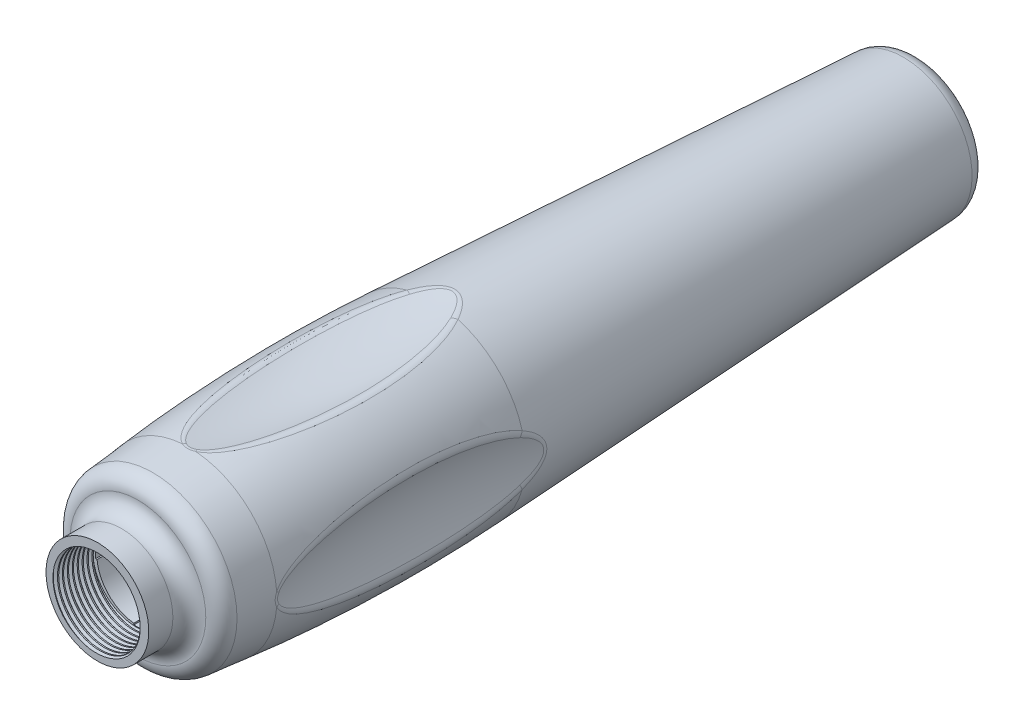
from build123d import *

# Parameters (mm, degrees)
BOSS_EXTRUDE1_DEPTH      = 51
BOSS_EXTRUDE1_DEPTH_BACK = 35
SKETCH1_R                = 11.25
SKETCH1_R_2              = 5
SKETCH2_R                = 11.25
BOSS_EXTRUDE2_DEPTH      = 9
CUT_EXTRUDE1_DEPTH       = 6
CUT_EXTRUDE2_START       = -2.5
SKETCH4_W                = 10
SKETCH4_H                = 2.5
CUT_EXTRUDE2_DEPTH       = 5
SKETCH5_R                = 2.5
CUT_EXTRUDE3_DEPTH       = 7.5
SKETCH6_W                = 1
SKETCH6_H                = 0.25
SKETCH6_W_2              = 0.25
SKETCH6_H_2              = 1
CUT_EXTRUDE4_DEPTH       = 10
SKETCH7_W                = 22.5
SKETCH7_H                = 22.5
SKETCH7_R                = 7.5
BOSS_EXTRUDE3_DEPTH      = 55
SKETCH11_R               = 6.25
SKETCH11_R_2             = 5.5
BOSS_EXTRUDE4_DEPTH      = 5
THREAD1_PITCH            = 0.6
SKETCH14_W               = 14.477531198
SKETCH14_H               = 32.54061919
CUT_EXTRUDE5_DEPTH       = 30
CIRPATTERN1_COUNT        = 4
FILLET11_R               = 198
FILLET13_R               = 1.25
FILLET14_R               = 2
FILLET15_R               = 2


with BuildPart() as part:
    # Sketch1 → Boss-Extrude1 (new, two sides: drawn at the far end of the back side and taken through both)
    with BuildSketch(Plane.XY.offset(-BOSS_EXTRUDE1_DEPTH_BACK)):
        Circle(SKETCH1_R)
        Circle(SKETCH1_R_2, mode=Mode.SUBTRACT)
    extrude(amount=BOSS_EXTRUDE1_DEPTH + BOSS_EXTRUDE1_DEPTH_BACK)

    # Sketch2 → Boss-Extrude2 (add)
    with BuildSketch(Plane(origin=(0, 0, -35), x_dir=(-1, 0, 0), z_dir=(0, 0, -1))):
        with Locations(Location((0, 0, 0), (0, 0, 180))):
            Circle(SKETCH2_R)
    extrude(amount=BOSS_EXTRUDE2_DEPTH)

    # Sketch3 → Cut-Extrude1 (cut)
    with BuildSketch(Plane(origin=(0, 0, -44), x_dir=(-1, 0, 0), z_dir=(0, 0, -1))):
        Polygon((-2, 4.5), (-3, 3.5), (-3, 2.5), (3, 2.5), (3, 3.5), (2, 4.5), align=None)
    extrude(amount=-CUT_EXTRUDE1_DEPTH, mode=Mode.SUBTRACT)

    # Sketch4 → Cut-Extrude2 (cut)
    with BuildSketch(Plane(origin=(0, 0, -44), x_dir=(-1, 0, 0), z_dir=(0, 0, -1)).offset(CUT_EXTRUDE2_START)):
        with Locations((0, -2.25)):
            Rectangle(SKETCH4_W, SKETCH4_H)
    extrude(amount=-CUT_EXTRUDE2_DEPTH, mode=Mode.SUBTRACT)

    # Sketch5 → Cut-Extrude3 (cut)
    with BuildSketch(Plane(origin=(0, 0, -44), x_dir=(-1, 0, 0), z_dir=(0, 0, -1))):
        with Locations((0, -3.5)):
            Circle(SKETCH5_R)
    extrude(amount=-CUT_EXTRUDE3_DEPTH, mode=Mode.SUBTRACT)

    # Sketch6 → Cut-Extrude4 (cut)
    with BuildSketch(Plane.XY.offset(51)):
        with Locations((0, 5.025)):
            Rectangle(SKETCH6_W, SKETCH6_H)
        with Locations((-5.025, 0)):
            Rectangle(SKETCH6_W_2, SKETCH6_H_2)
        with Locations((5.025, 0)):
            Rectangle(SKETCH6_W_2, SKETCH6_H_2)
        with Locations((0, -5.025)):
            Rectangle(SKETCH6_W, SKETCH6_H)
    extrude(amount=-CUT_EXTRUDE4_DEPTH, mode=Mode.SUBTRACT)

    # Sketch7 → Boss-Extrude3 (add)
    with BuildSketch(Plane.XY.offset(51)):
        Rectangle(SKETCH7_W, SKETCH7_H)
        Circle(SKETCH7_R, mode=Mode.SUBTRACT)
    extrude(amount=-BOSS_EXTRUDE3_DEPTH)

    # Sketch11 → Boss-Extrude4 (add)
    with BuildSketch(Plane.XY.offset(51)):
        Circle(SKETCH11_R)
        Circle(SKETCH11_R_2, mode=Mode.SUBTRACT)
    extrude(amount=BOSS_EXTRUDE4_DEPTH)

    # Thread1: the profile of Thread Profile1 profile screwed along a right-hand helix of 10 turns, 6 arcs to a turn; built about Z, then put on its axis
    thread1_z = Axis((0, 0, 0), (0, 0, 1))
    thread1_corners = [(5.5003, 0, -0.000173205), (5.5003, 0, 0.525173203), (5.175240475, 0, 0.337499999), (5.175240475, 0, 0.187499999)]
    with BuildLine(mode=Mode.PRIVATE) as thread1_profile:
        Line(thread1_corners[0], thread1_corners[1])
        Line(thread1_corners[1], thread1_corners[2])
        Line(thread1_corners[2], thread1_corners[3])
        Line(thread1_corners[3], thread1_corners[0])
    thread1_cap = Face(thread1_profile.wire())
    thread1_turn_angles = [0, 30, 60, 90, 120, 150, 180, 210, 240, 270, 300, 330, 360]
    thread1_turn_weights = [1, 0.8660254037844387, 1, 0.8660254037844387, 1, 0.8660254037844387, 1, 0.8660254037844387, 1, 0.8660254037844387, 1, 0.8660254037844387, 1]
    thread1_turn_rails = [Edge.make_bspline([Vector(p[0], p[1], 0).rotate(thread1_z, thread1_turn_angles[k]) / thread1_turn_weights[k] + Vector(0, 0, p[2] + THREAD1_PITCH * thread1_turn_angles[k] / 360) for k in range(13)], [0, 0, 0, 1, 1, 2, 2, 3, 3, 4, 4, 5, 5, 6, 6, 6], 2, thread1_turn_weights) for p in thread1_corners]
    thread1_turn_sides = [Face.make_surface_from_curves(thread1_turn_rails[p[0]], thread1_turn_rails[p[1]]) for p in [(0, 1), (1, 2), (2, 3), (3, 0)]]
    thread1 = Plane(origin=(0, 0, 57), x_dir=(-1, 0, 0), z_dir=(0, 0, -1)) * Solid(Shell([*[p.moved(Location((0, 0, THREAD1_PITCH * i))) for i in range(10) for p in thread1_turn_sides], thread1_cap, thread1_cap.rotate(thread1_z, 3600).moved(Location((0, 0, THREAD1_PITCH * 3600 / 360)))]))
    add(thread1)

    # Sketch14 → Cut-Extrude5 (cut)
    with BuildSketch(Plane(origin=(11.25, 0, 0), x_dir=(0, 0, -1), z_dir=(1, 0, 0))):
        with Locations((-63.170516655, 2.469298546)):
            Rectangle(SKETCH14_W, SKETCH14_H)
    extrude(amount=-CUT_EXTRUDE5_DEPTH, mode=Mode.SUBTRACT)

    # Sketch15 → Cut-Revolve2 (revolve, cut)
    with BuildSketch(Plane(origin=(0, 0, 0), x_dir=(1, 0, 0), z_dir=(0, 1, 0)), mode=Mode.PRIVATE) as cut_revolve2_sk:
        Polygon((-8.2, 44.75), (-12.117481501, -30), (-8.213792673, -70), (-14.213792673, -70), (-53.2, -813.901150948), (-53.2, 44.75), align=None)
    revolve(cut_revolve2_sk.sketch.rotate(Axis((0, 0, 0), (0, 0, -1)), 21.811581298), axis=Axis((0, 0, 0), (0, 0, -1)), mode=Mode.SUBTRACT)

    # Sketch17 → Cut-Revolve3 (revolve, cut)
    with BuildSketch(Plane(origin=(0, 22.25, 0), x_dir=(1, 0, 0), z_dir=(0, 1, 0))):
        with BuildLine():
            Line((0, 8.75), (0, -80.25))
            add(Edge.make_bspline(
                [(0, 8.75), (-11.417317651, -3.383405443), (-15.561847279, -36.022081674), (-7.523975784, -66.531911088), (0, -80.25)],
                knots=[0, 0, 0, 0, 0.50411991, 1, 1, 1, 1], degree=3))
        make_face()
    cut_revolve3 = revolve(axis=Axis((0, 22.25, -8.75), (0, 0, 1)), mode=Mode.SUBTRACT)

    # CirPattern1: Cut-Revolve3 ×4 about axis
    cirpattern1_axis = Axis((0, 0, 56), (0, 0, -1))
    for i in range(1, CIRPATTERN1_COUNT):
        add(cut_revolve3.rotate(cirpattern1_axis, i * 360 / CIRPATTERN1_COUNT), mode=Mode.SUBTRACT)

    # Fillet11
    # the kernel refuses this fillet: 198 mm, written as the material it takes off along each edge
    with BuildSketch(Plane(origin=(0, 0, 30), x_dir=(0.7093247295722744, 0.7048818539423609, 0), z_dir=(-0.7048818539423609, 0.7093247295722744, 0))) as fillet11_piece_1:
        with BuildLine():
            CenterArc((12.117481501 - FILLET11_R * 1.00255274023, FILLET11_R * 0.0225232637006), FILLET11_R, 354.426028867, 8.573971133)
            Line((12.117481501 - FILLET11_R * 0.0039232054761, FILLET11_R * 0.0748592199435), (12.117481501, 0))
            Line((12.117481501, 0), (12.117481501 - FILLET11_R * 0.00728111206666, -FILLET11_R * 0.0746075047085))
        make_face()
    revolve(axis=Axis((0, 0, 30), (0, 0, -1)), revolution_arc=359.64, mode=Mode.SUBTRACT)
    with BuildSketch(Plane(origin=(0, 0, 30), x_dir=(-0.7048818539423612, 0.7093247295722741, 0), z_dir=(-0.7093247295722741, -0.7048818539423612, 0))) as fillet11_piece_2:
        with BuildLine():
            CenterArc((12.117481501 - FILLET11_R * 1.00255274023, FILLET11_R * 0.0225232637006), FILLET11_R, 354.426028867, 8.573971133)
            Line((12.117481501 - FILLET11_R * 0.0039232054761, FILLET11_R * 0.0748592199435), (12.117481501, 0))
            Line((12.117481501, 0), (12.117481501 - FILLET11_R * 0.00728111206666, -FILLET11_R * 0.0746075047085))
        make_face()
    revolve(axis=Axis((0, 0, 30), (0, 0, -1)), revolution_arc=359.64, mode=Mode.SUBTRACT)
    with BuildSketch(Plane(origin=(0, 0, 30), x_dir=(0.704881853942361, -0.7093247295722742, 0), z_dir=(0.7093247295722742, 0.704881853942361, 0))) as fillet11_piece_3:
        with BuildLine():
            CenterArc((12.117481501 - FILLET11_R * 1.00255274023, FILLET11_R * 0.0225232637006), FILLET11_R, 354.426028867, 8.573971133)
            Line((12.117481501 - FILLET11_R * 0.0039232054761, FILLET11_R * 0.0748592199435), (12.117481501, 0))
            Line((12.117481501, 0), (12.117481501 - FILLET11_R * 0.00728111206666, -FILLET11_R * 0.0746075047085))
        make_face()
    revolve(axis=Axis((0, 0, 30), (0, 0, -1)), revolution_arc=359.64, mode=Mode.SUBTRACT)
    with BuildSketch(Plane(origin=(0, 0, 30), x_dir=(-0.709324729572274, -0.7048818539423612, 0), z_dir=(0.7048818539423612, -0.709324729572274, 0))) as fillet11_piece_4:
        with BuildLine():
            CenterArc((12.117481501 - FILLET11_R * 1.00255274023, FILLET11_R * 0.0225232637006), FILLET11_R, 354.426028867, 8.573971133)
            Line((12.117481501 - FILLET11_R * 0.0039232054761, FILLET11_R * 0.0748592199435), (12.117481501, 0))
            Line((12.117481501, 0), (12.117481501 - FILLET11_R * 0.00728111206666, -FILLET11_R * 0.0746075047085))
        make_face()
    revolve(axis=Axis((0, 0, 30), (0, 0, -1)), revolution_arc=359.64, mode=Mode.SUBTRACT)

    # Fillet13
    fillet13_edges = [part.edges().sort_by_distance(p)[0] for p in [
        (-10.671553962, -1.23e-07, 44.816012237),
        (3e-09, -10.671553963, 44.816012256),
        (10.671553963, 3e-09, 44.816012256),
        (-3e-09, 10.671553963, 44.816012256),
        (11.208221757, -3e-08, 12.650290525),
        (10.492126031, 4.833059496, 30.425738322),
        (10.492126031, -4.833059496, 30.425738321),
        (-11.20822176, -1e-09, 12.650290507),
        (3e-08, 11.208221757, 12.650290525),
        (-3e-08, -11.208221761, 12.650290512),
        (-4.833059496, -10.492126031, 30.425738321),
        (4.833059496, -10.492126031, 30.425738322),
        (-10.492126031, 4.833059496, 30.425738321),
        (-10.492126031, -4.833059496, 30.425738322),
        (4.833059496, 10.492126031, 30.425738321),
        (-4.833059496, 10.492126031, 30.425738322),
    ]]
    fillet(fillet13_edges, radius=FILLET13_R)

    # Fillet14
    fillet14_edges = [part.edges().sort_by_distance(p)[0] for p in [
        (-6.25, 0, 51),
        (9.347281012, -3.740837489, 51),
    ]]
    fillet(fillet14_edges, radius=FILLET14_R)

    # Fillet15
    fillet15_edges = [part.edges().sort_by_distance(p)[0] for p in [
        (7.649460049, -3.061359436, -44),
    ]]
    fillet(fillet15_edges, radius=FILLET15_R)


solid = part.part
